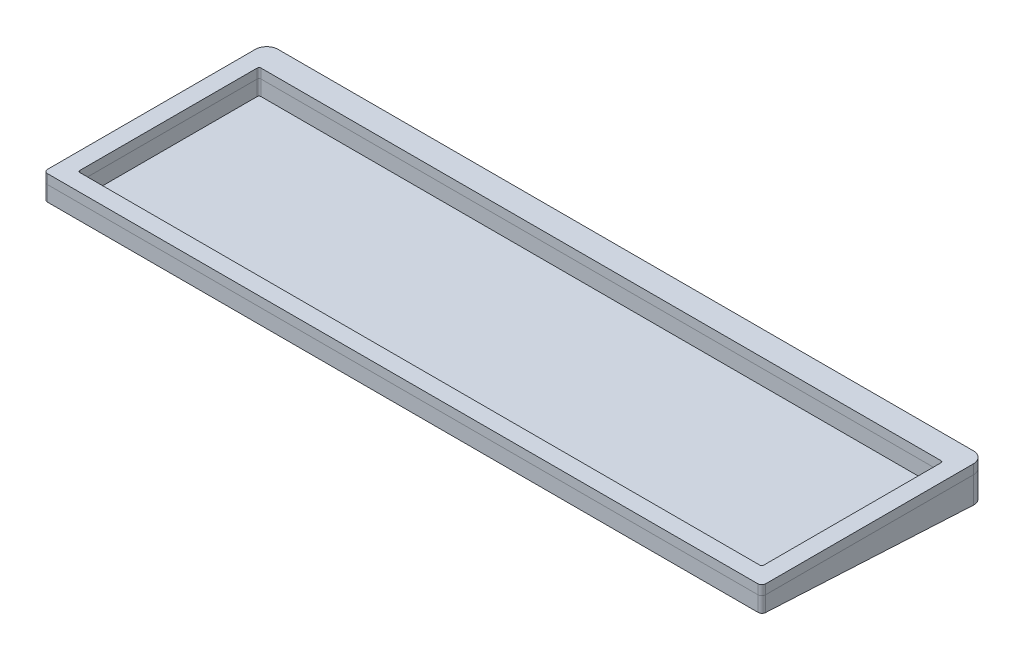
from build123d import *

# Parameters (mm, degrees)
BOSS_EXTRUDE1_DEPTH = 13
BOSS_EXTRUDE3_START = 10.5
BOSS_EXTRUDE3_DEPTH = 10.5
CUT_EXTRUDE4_DEPTH  = 400


with BuildPart() as part:
    # Sketch2 → Boss-Extrude1 (new body)
    with BuildSketch(Plane(origin=(0, 0, 0), x_dir=(1, 0, 0), z_dir=(0, 1, 0))):
        with BuildLine():
            Line((182.825, 60.625), (-182.825, 60.625))
            ThreePointArc((-182.825, 60.625), (-187.067640687, 58.867640687), (-188.825, 54.625))
            Line((-188.825, 54.625), (-188.825, -54.625))
            ThreePointArc((-188.825, -54.625), (-188.239213562, -56.039213562), (-186.825, -56.625))
            Line((-186.825, -56.625), (186.825, -56.625))
            ThreePointArc((186.825, -56.625), (188.239213562, -56.039213562), (188.825, -54.625))
            Line((188.825, -54.625), (188.825, 54.625))
            ThreePointArc((188.825, 54.625), (187.067640687, 58.867640687), (182.825, 60.625))
        make_face()
        with BuildLine():
            Line((-179.825, -46.625), (-179.825, 46.625))
            ThreePointArc((-179.825, 46.625), (-179.532106781, 47.332106781), (-178.825, 47.625))
            Line((-178.825, 47.625), (178.825, 47.625))
            ThreePointArc((178.825, 47.625), (179.532106781, 47.332106781), (179.825, 46.625))
            Line((179.825, 46.625), (179.825, -46.625))
            ThreePointArc((179.825, -46.625), (179.532106781, -47.332106781), (178.825, -47.625))
            Line((178.825, -47.625), (-178.825, -47.625))
            ThreePointArc((-178.825, -47.625), (-179.532106781, -47.332106781), (-179.825, -46.625))
        make_face(mode=Mode.SUBTRACT)
    extrude(amount=BOSS_EXTRUDE1_DEPTH)

    # Sketch4 → Boss-Extrude3 (add)
    with BuildSketch(Plane.XZ.offset(BOSS_EXTRUDE3_START)):
        with BuildLine():
            ThreePointArc((182.825, -60.625), (187.067640687, -58.867640687), (188.825, -54.625))
            Line((188.825, -54.625), (188.825, 54.625))
            ThreePointArc((188.825, 54.625), (188.239213562, 56.039213562), (186.825, 56.625))
            Line((186.825, 56.625), (-186.825, 56.625))
            ThreePointArc((-186.825, 56.625), (-188.239213562, 56.039213562), (-188.825, 54.625))
            Line((-188.825, 54.625), (-188.825, -54.625))
            ThreePointArc((-188.825, -54.625), (-187.067640687, -58.867640687), (-182.825, -60.625))
            Line((-182.825, -60.625), (182.825, -60.625))
        make_face()
    extrude(amount=-BOSS_EXTRUDE3_DEPTH)

    # Sketch8 → Cut-Extrude4 (cut)
    with BuildSketch(Plane.ZY.offset(188.825)):
        Polygon((-60.625, -6.144812121), (-60.625, -10.5), (56.625, -10.5), (56.625, 0), align=None)
    extrude(amount=-CUT_EXTRUDE4_DEPTH, mode=Mode.SUBTRACT)


with BuildPart() as body_2:
    # Split1: the piece on the far side of the plane
    add(part.part)
    split(bisect_by=Plane.ZX.offset(8), keep=Keep.BOTTOM)


with BuildPart() as part_1:
    add(part.part)

    # Split1
    split(bisect_by=Plane.ZX.offset(8), keep=Keep.TOP)


solid = Compound([body_2.part, part_1.part])
